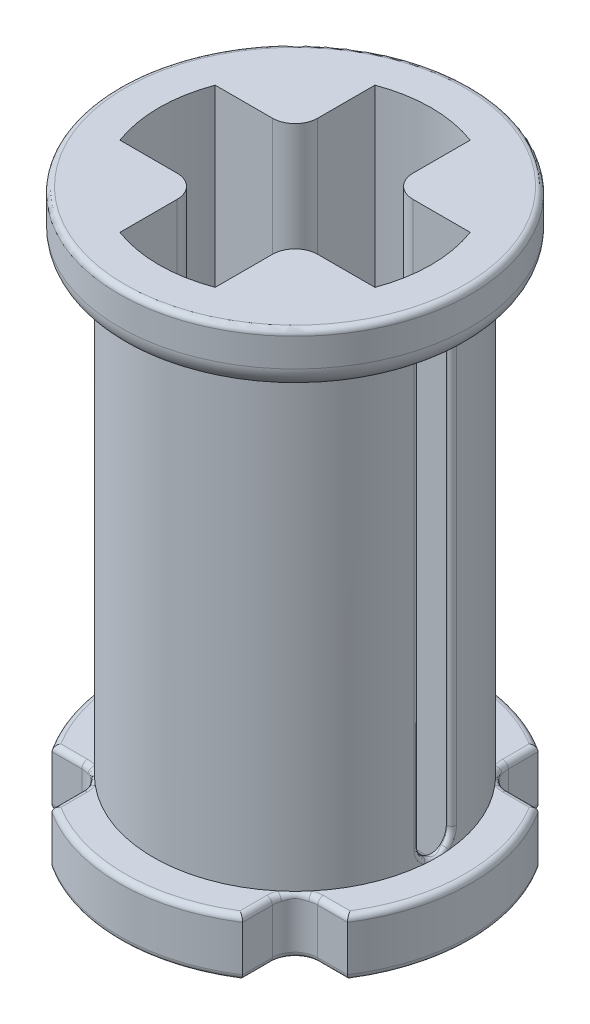
from build123d import *

# Parameters (mm, degrees)
SKETCH8_R               = 3.1
BOSS_EXTRUDE4_DEPTH     = 10
CUT_EXTRUDE1_DEPTH      = 10
CUT_EXTRUDE2_DEPTH      = 9
SKETCH13_R              = 3.1
SKETCH13_R_2            = 2.5
CUT_EXTRUDE4_DEPTH      = 4
FILLET1_R               = 0.1
FILLET2_R               = 0.4
CUT_EXTRUDE5_DEPTH      = 3
CUT_EXTRUDE5_DEPTH_BACK = 3
FILLET3_R               = 0.1
FILLET4_R               = 0.1
FILLET5_R               = 0.08


with BuildPart() as part:
    # Sketch8 → Boss-Extrude4 (new body)
    with BuildSketch(Plane(origin=(0, 0, 0), x_dir=(1, 0, 0), z_dir=(0, 1, 0))):
        Circle(SKETCH8_R)
    extrude(amount=BOSS_EXTRUDE4_DEPTH)

    # Sketch9 → Cut-Extrude1 (cut)
    with BuildSketch(Plane(origin=(0, 0, 0), x_dir=(1, 0, 0), z_dir=(0, 1, 0))):
        with BuildLine():
            Line((2.248199279, 0.84), (1.24, 0.84))
            ThreePointArc((1.24, 0.84), (0.957157288, 0.957157288), (0.84, 1.24))
            Line((0.84, 1.24), (0.84, 2.248199279))
            ThreePointArc((0.84, 2.248199279), (0, 2.4), (-0.84, 2.248199279))
            Line((-0.84, 2.248199279), (-0.84, 1.24))
            ThreePointArc((-0.84, 1.24), (-0.957157288, 0.957157288), (-1.24, 0.84))
            Line((-1.24, 0.84), (-2.248199279, 0.84))
            ThreePointArc((-2.248199279, 0.84), (-2.4, 0), (-2.248199279, -0.84))
            Line((-2.248199279, -0.84), (-1.24, -0.84))
            ThreePointArc((-1.24, -0.84), (-0.957157288, -0.957157288), (-0.84, -1.24))
            Line((-0.84, -1.24), (-0.84, -2.248199279))
            ThreePointArc((-0.84, -2.248199279), (0, -2.4), (0.84, -2.248199279))
            Line((0.84, -2.248199279), (0.84, -1.24))
            ThreePointArc((0.84, -1.24), (0.957157288, -0.957157288), (1.24, -0.84))
            Line((1.24, -0.84), (2.248199279, -0.84))
            ThreePointArc((2.248199279, -0.84), (2.361744934, -0.426803075), (2.4, 0))
            ThreePointArc((2.4, 0), (2.361744934, 0.426803075), (2.248199279, 0.84))
        make_face()
    extrude(amount=CUT_EXTRUDE1_DEPTH, mode=Mode.SUBTRACT)

    # Sketch10 → Cut-Extrude2 (cut)
    with BuildSketch(Plane.XZ):
        with BuildLine():
            ThreePointArc((-1.68, -2.08), (-1.797157288, -1.797157288), (-2.08, -1.68))
            Line((-2.08, -1.68), (-2.605302286, -1.68))
            ThreePointArc((-2.605302286, -1.68), (-2.192031022, -2.192031022), (-1.68, -2.605302286))
            Line((-1.68, -2.605302286), (-1.68, -2.08))
        make_face()
        with BuildLine():
            ThreePointArc((-1.68, 2.605302286), (-2.192031022, 2.192031022), (-2.605302286, 1.68))
            Line((-2.605302286, 1.68), (-2.08, 1.68))
            ThreePointArc((-2.08, 1.68), (-1.797157288, 1.797157288), (-1.68, 2.08))
            Line((-1.68, 2.08), (-1.68, 2.605302286))
        make_face()
        with BuildLine():
            Line((1.68, -2.08), (1.68, -2.605302286))
            ThreePointArc((1.68, -2.605302286), (2.192031022, -2.192031022), (2.605302286, -1.68))
            Line((2.605302286, -1.68), (2.08, -1.68))
            ThreePointArc((2.08, -1.68), (1.797157288, -1.797157288), (1.68, -2.08))
        make_face()
        with BuildLine():
            ThreePointArc((2.605302286, 1.68), (2.192031022, 2.192031022), (1.68, 2.605302286))
            Line((1.68, 2.605302286), (1.68, 2.08))
            ThreePointArc((1.68, 2.08), (1.797157288, 1.797157288), (2.08, 1.68))
            Line((2.08, 1.68), (2.605302286, 1.68))
        make_face()
    extrude(amount=-CUT_EXTRUDE2_DEPTH, mode=Mode.SUBTRACT)

    # Sketch13 → Cut-Extrude4 (cut, symmetric)
    with BuildSketch(Plane(origin=(0, 5, 0), x_dir=(1, 0, 0), z_dir=(0, 1, 0))):
        Circle(SKETCH13_R)
        Circle(SKETCH13_R_2, mode=Mode.SUBTRACT)
    extrude(amount=CUT_EXTRUDE4_DEPTH, both=True, mode=Mode.SUBTRACT)

    # Fillet1
    fillet1_edges = [part.edges().sort_by_distance(p)[0] for p in [
        (-2.342651143, 0, -1.68),
        (-1.797157288, 0, -1.797157288),
        (-1.68, 0, 2.342651143),
        (-1.797157288, 0, 1.797157288),
        (1.68, 0, 2.342651143),
        (1.797157288, 0, 1.797157288),
        (-3.1, 0, 0),
        (-1.68, 0, -2.342651143),
        (-2.342651143, 0, 1.68),
        (2.342651143, 0, 1.68),
        (0, 0, 3.1),
        (3.1, 0, 0),
        (0, 0, -3.1),
        (2.342651143, 0, -1.68),
        (1.797157288, 0, -1.797157288),
        (1.68, 0, -2.342651143),
        (0, 0, -2.4),
        (0.84, 0, -1.74409964),
        (0.957157288, 0, -0.957157288),
        (1.74409964, 0, -0.84),
        (2.4, 0, 0),
        (1.74409964, 0, 0.84),
        (0.957157288, 0, 0.957157288),
        (0.84, 0, 1.74409964),
        (0, 0, 2.4),
        (-0.84, 0, 1.74409964),
        (-0.957157288, 0, 0.957157288),
        (-1.74409964, 0, 0.84),
        (-2.4, 0, 0),
        (-1.74409964, 0, -0.84),
        (-0.957157288, 0, -0.957157288),
        (-0.84, 0, -1.74409964),
    ]]
    fillet(fillet1_edges, radius=FILLET1_R)

    # Fillet2
    fillet2_edges = [part.edges().sort_by_distance(p)[0] for p in [
        (-3.1, 9, 0),
    ]]
    fillet(fillet2_edges, radius=FILLET2_R)

    # Sketch15 → Cut-Extrude5 (cut, two sides: drawn at the far end of the back side and taken through both)
    with BuildSketch(Plane(origin=(0, 0, 0), x_dir=(0, 0, -1), z_dir=(1, 0, 0)).offset(-CUT_EXTRUDE5_DEPTH_BACK)):
        with BuildLine():
            Line((0.284291097, 8.705865834), (0.284291097, 1.294134166))
            ThreePointArc((0.284291097, 1.294134166), (0, 1.009843068), (-0.284291097, 1.294134166))
            Line((-0.284291097, 1.294134166), (-0.284291097, 8.705865834))
            ThreePointArc((-0.284291097, 8.705865834), (0, 8.990156932), (0.284291097, 8.705865834))
        make_face()
    extrude(amount=CUT_EXTRUDE5_DEPTH + CUT_EXTRUDE5_DEPTH_BACK, mode=Mode.SUBTRACT)

    # Fillet3
    fillet3_edges = [part.edges().sort_by_distance(p)[0] for p in [
        (-3.1, 10, 0),
    ]]
    fillet(fillet3_edges, radius=FILLET3_R)

    # Fillet4
    fillet4_edges = [part.edges().sort_by_distance(p)[0] for p in [
        (1.68, 1, 2.342651143),
        (1.797157288, 1, 1.797157288),
        (2.342651143, 1, -1.68),
        (1.797157288, 1, -1.797157288),
        (-1.68, 1, 2.342651143),
        (-1.797157288, 1, 1.797157288),
        (-1.68, 1, -2.342651143),
        (-1.797157288, 1, -1.797157288),
        (2.342651143, 1, 1.68),
        (1.68, 1, -2.342651143),
        (3.1, 1, 0),
        (-2.342651143, 1, 1.68),
        (0, 1, 3.1),
        (0, 1, -3.1),
        (-2.342651143, 1, -1.68),
        (-3.1, 1, 0),
    ]]
    fillet(fillet4_edges, radius=FILLET4_R)

    # Fillet5
    fillet5_edges = [part.edges().sort_by_distance(p)[0] for p in [
        (-2.5, 8.990156932, 0),
        (-2.483783117, 5, 0.284291097),
        (-2.5, 1.009843068, 0),
        (2.491904722, 1.093110362, -0.201024516),
        (2.483783117, 5, 0.284291097),
        (2.491904722, 8.906889638, 0.201024516),
        (-2.483783117, 5, -0.284291097),
        (2.483783117, 5, -0.284291097),
    ]]
    fillet(fillet5_edges, radius=FILLET5_R)


solid = part.part
